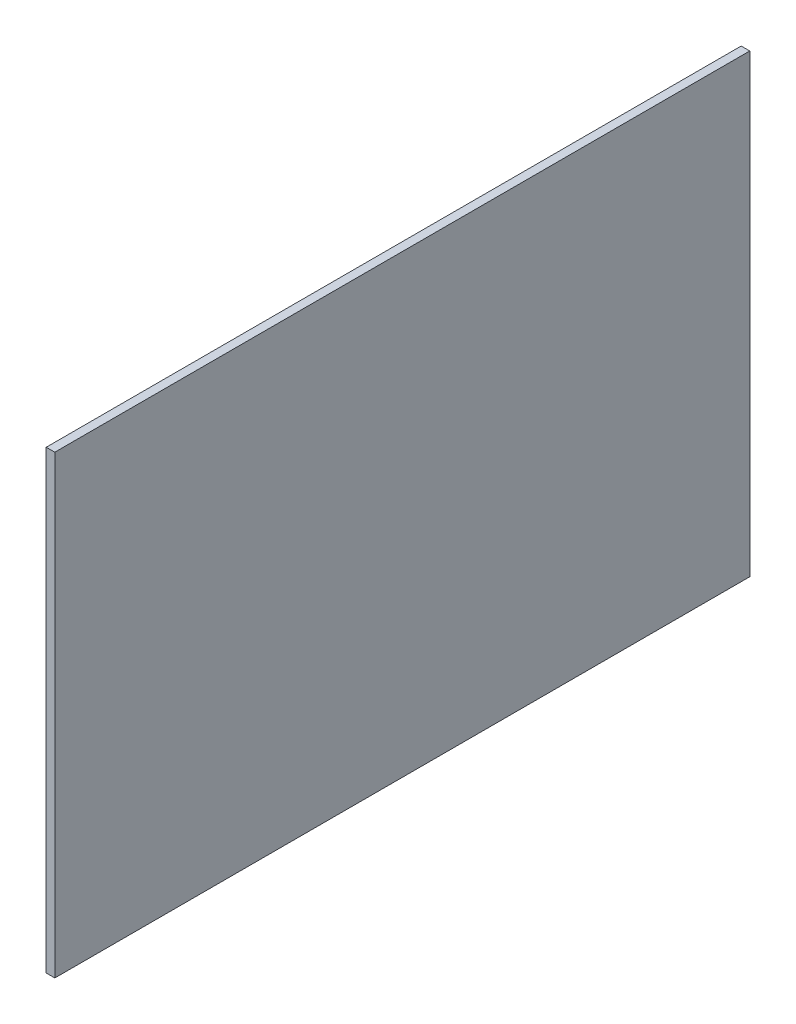
from build123d import *

# Parameters (mm, degrees)
BOSS_EXTRUDE1_DEPTH = 674.135566945


with BuildPart() as part:
    # Sketch1 → Boss-Extrude1 (new body)
    with BuildSketch(Plane(origin=(0, 0, 0), x_dir=(1, 0, 0), z_dir=(0, 1, 0))):
        Polygon((304, 55.73), (304, -749.262699094), (316.7, -749.262699094), (316.7, 55.73), (316.7, 279.534587306), (304, 279.534587306), align=None)
    extrude(amount=BOSS_EXTRUDE1_DEPTH)


solid = part.part
